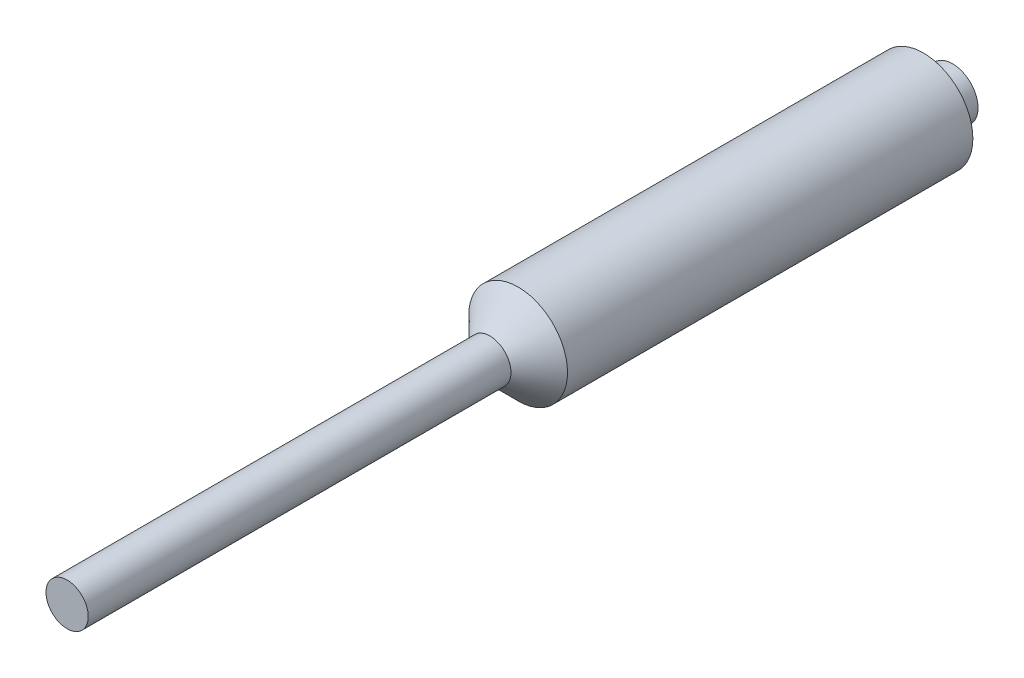
from build123d import *

# Parameters (mm, degrees)
SKETCH1_R           = 5.49275
BOSS_EXTRUDE1_DEPTH = 49.53
SKETCH2_R           = 2.3495
BOSS_EXTRUDE2_DEPTH = 45.72
CHAMFER1_SIZE       = 4.445
SKETCH3_R           = 2.8321
BOSS_EXTRUDE3_DEPTH = 3.2385


with BuildPart() as part:
    # Sketch1 → Boss-Extrude1 (new body)
    with BuildSketch(Plane.XY):
        Circle(SKETCH1_R)
    extrude(amount=BOSS_EXTRUDE1_DEPTH)

    # Sketch2 → Boss-Extrude2 (add)
    with BuildSketch(Plane.XY.offset(49.53)):
        Circle(SKETCH2_R)
    extrude(amount=BOSS_EXTRUDE2_DEPTH)

    # Chamfer1
    # the kernel refuses this chamfer: 4.445 mm, written as the material it takes off along each edge
    with BuildSketch(Plane(origin=(0, 0, 49.53), x_dir=(1, 0, 0), z_dir=(0, -1, 0))) as chamfer1_piece_1_section:
        Polygon((5.49275, -CHAMFER1_SIZE), (5.49275 - CHAMFER1_SIZE, 0), (5.49275, 0), align=None)
    chamfer1_piece_1 = revolve(axis=Axis((0, 0, 49.53), (0, 0, 1)), mode=Mode.PRIVATE)
    chamfer1_piece_1 = chamfer1_piece_1 - Plane(origin=(0, 0, 46.639044466), x_dir=(1, 0, 0), z_dir=(0, 0, -1)) * Cylinder(2.3495, 22, mode=Mode.PRIVATE)
    add(chamfer1_piece_1, mode=Mode.SUBTRACT)

    # Sketch3 → Boss-Extrude3 (add)
    with BuildSketch(Plane(origin=(0, 0, 0), x_dir=(-1, 0, 0), z_dir=(0, 0, -1))):
        Circle(SKETCH3_R)
    extrude(amount=BOSS_EXTRUDE3_DEPTH)


solid = part.part
